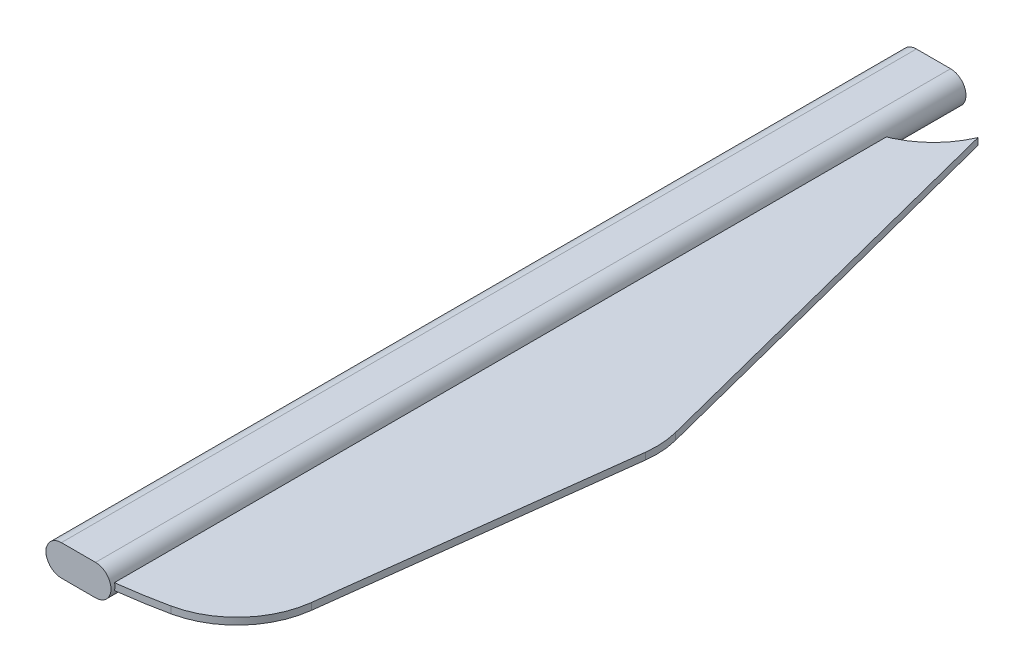
from build123d import *

# Parameters (mm, degrees)
BOSS_EXTRUDE1_DEPTH      = 20
BOSS_EXTRUDE1_DEPTH_BACK = 20


with BuildPart() as part:
    # Sweep1: sweep along a path in Sketch2
    with BuildLine(Plane(origin=(0, 0, 0), x_dir=(1, 0, 0), z_dir=(0, 1, 0))) as sweep1_path:
        Line((0, 0), (0, -5000))
    # Sketch1 → Sweep1 (sweep)
    with BuildSketch(Plane.XY):
        with BuildLine():
            Line((-100, 90), (100, 90))
            ThreePointArc((100, 90), (190, 0), (100, -90))
            Line((100, -90), (-100, -90))
            ThreePointArc((-100, -90), (-190, 0), (-100, 90))
        make_face()
    sweep(path=sweep1_path.line)


with BuildPart() as body_2:
    # Sketch3 → Boss-Extrude1 (new, two sides: drawn at the far end of the back side and taken through both)
    with BuildSketch(Plane(origin=(0, 0, 0), x_dir=(1, 0, 0), z_dir=(0, 1, 0)).offset(-BOSS_EXTRUDE1_DEPTH_BACK)):
        with BuildLine():
            Line((-190, -462.493243194), (-190, -5000))
            ThreePointArc((-190, -5000), (142.992317957, -4982.505637339), (472.318361449, -4930.215163814))
            ThreePointArc((472.318361449, -4930.215163814), (736.625343575, -4779.125404255), (864.307314846, -4502.749554266))
            Line((864.307314846, -4502.749554266), (1080.044711749, -2763.673353862))
            ThreePointArc((1080.044711749, -2763.673353862), (1082.836076898, -2670.321787001), (1068.218138905, -2578.07959143))
            Line((1068.218138905, -2578.07959143), (458.870236232, -198.590297599))
            ThreePointArc((458.870236232, -198.590297599), (188.371951618, -463.158728563), (-190, -462.493243194))
        make_face()
    extrude(amount=BOSS_EXTRUDE1_DEPTH + BOSS_EXTRUDE1_DEPTH_BACK)


solid = Compound([part.part, body_2.part])
